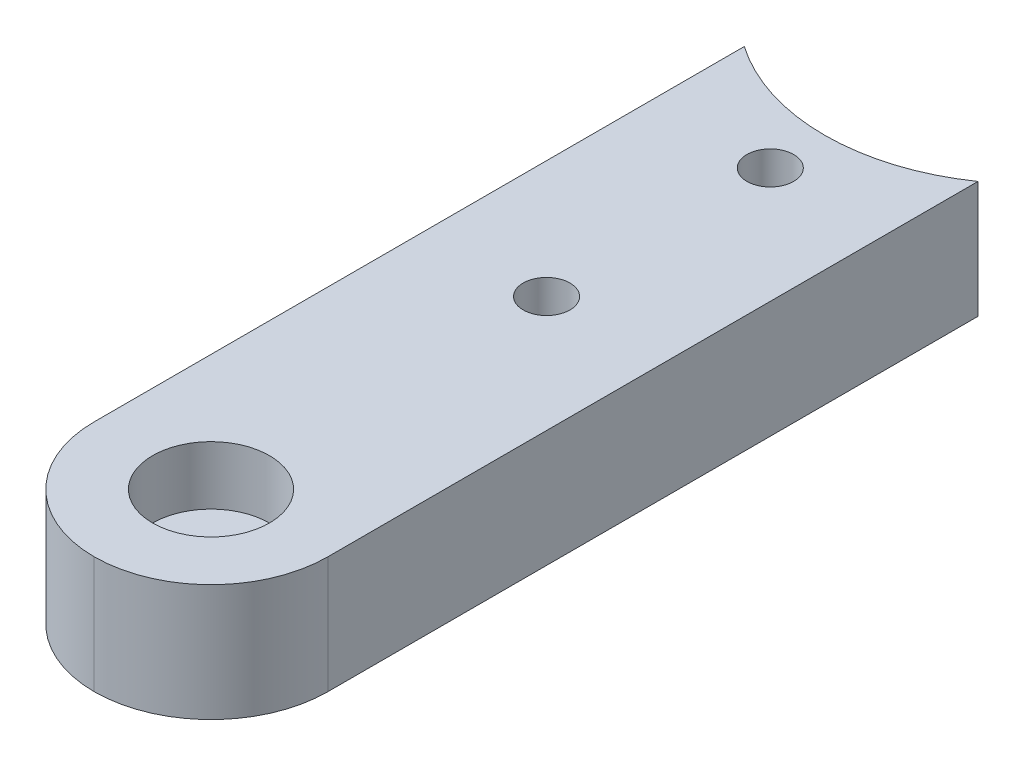
from build123d import *

# Parameters (mm, degrees)
SKETCH_1_W          = 4
SKETCH_1_H          = 15
EXTRUDE_1_DEPTH     = 2
SKETCH_3_R          = 0.4
CUT_EXTRUDE_1_DEPTH = 16.652475842
SKETCH_3_3_R        = 1
CUT_EXTRUDE_2_DEPTH = 1
SKETCH_4_R          = 3.5
CUT_EXTRUDE_3_DEPTH = 16.652475842
FILLET_1_R          = 2


with BuildPart() as part:
    # 草图1 → 凸台-拉伸1 (new body)
    with BuildSketch(Plane(origin=(0, 0, 0), x_dir=(1, 0, 0), z_dir=(0, 1, 0))):
        with Locations((2, -7.5)):
            Rectangle(SKETCH_1_W, SKETCH_1_H)
    extrude(amount=EXTRUDE_1_DEPTH)

    # 草图3 → 切除-拉伸1 (cut, through all)
    with BuildSketch(Plane(origin=(0, 2, 0), x_dir=(1, 0, 0), z_dir=(0, 1, 0))):
        with Locations(Location((2, -13, 0), (0, 0, 270))):
            Circle(SKETCH_3_R)
        with Locations(Location((2.022495613, -3.450026495, 0), (0, 0, 270))):
            Circle(SKETCH_3_R)
        with Locations(Location((2.013497368, -7.270015897, 0), (0, 0, 270))):
            Circle(SKETCH_3_R)
    extrude(amount=-CUT_EXTRUDE_1_DEPTH, mode=Mode.SUBTRACT)

    # 草图3<3> → 切除-拉伸2 (cut)
    with BuildSketch(Plane(origin=(0, 2, 0), x_dir=(1, 0, 0), z_dir=(0, 1, 0))):
        with Locations(Location((2, -13, 0), (0, 0, 270))):
            Circle(SKETCH_3_3_R)
    extrude(amount=-CUT_EXTRUDE_2_DEPTH, mode=Mode.SUBTRACT)

    # 草图4 → 切除-拉伸3 (cut, through all)
    with BuildSketch(Plane(origin=(0, 2, 0), x_dir=(1, 0, 0), z_dir=(0, 1, 0))):
        with Locations((2, 1)):
            Circle(SKETCH_4_R)
    extrude(amount=-CUT_EXTRUDE_3_DEPTH, mode=Mode.SUBTRACT)

    # 圆角1
    fillet_1_edges = [part.edges().sort_by_distance(p)[0] for p in [
        (4, 1, 15),
        (0, 1, 15),
    ]]
    fillet(fillet_1_edges, radius=FILLET_1_R - 0.0001)  # a hair under: the kernel refuses the full size


solid = part.part
